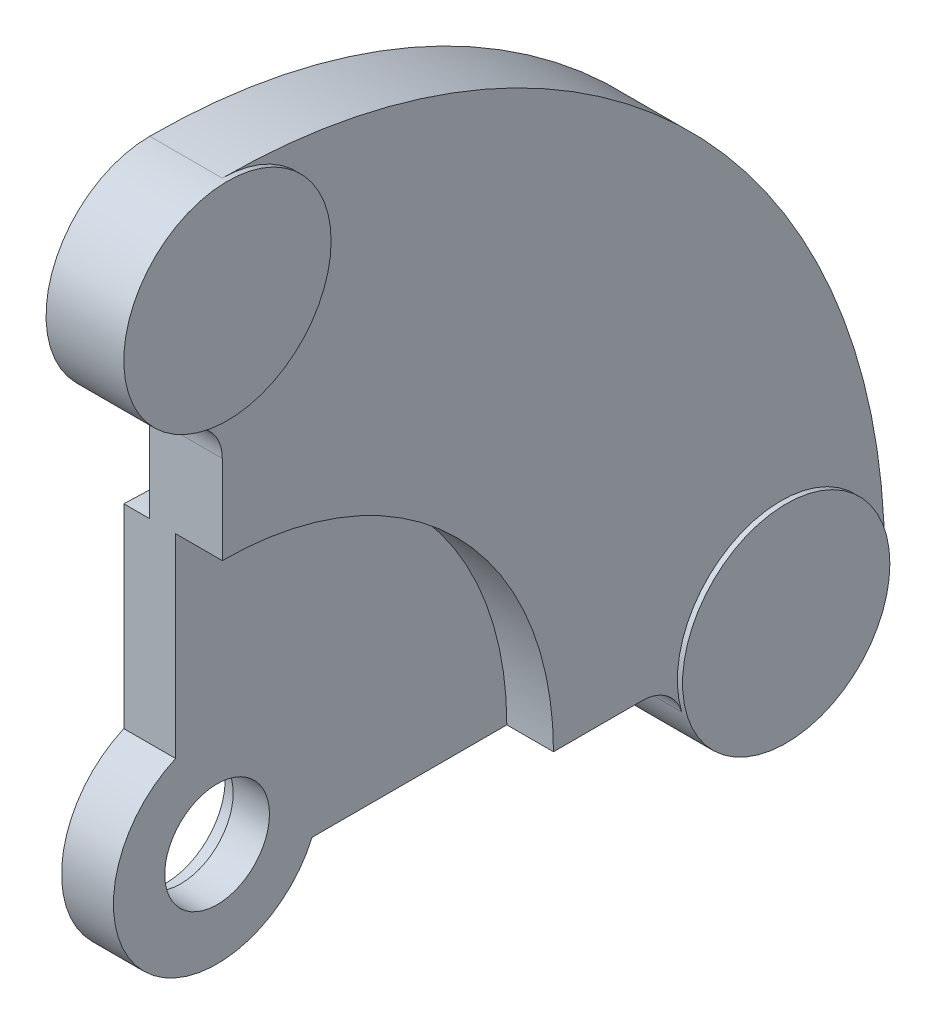
from build123d import *

# Parameters (mm, degrees)
SALIENTE_EXTRUIR1_DEPTH = 2.5
SALIENTE_EXTRUIR2_START = 7
SALIENTE_EXTRUIR2_DEPTH = 7
SALIENTE_EXTRUIR3_START = 7.5
CROQUIS2_4_R            = 10
SALIENTE_EXTRUIR3_DEPTH = 7.5
REDONDEO1_R             = 4
REDONDEO2_R             = 4
CROQUIS3_R              = 10
SALIENTE_EXTRUIR4_DEPTH = 5
CROQUIS4_R              = 5.05
CORTAR_EXTRUIR1_DEPTH   = 131
CROQUIS5_R              = 5.78
CORTAR_EXTRUIR2_DEPTH   = 1.5


with BuildPart() as part:
    # Croquis2 → Saliente-Extruir1 (new, symmetric)
    with BuildSketch(Plane(origin=(0, 0, 0), x_dir=(0, 0, -1), z_dir=(1, 0, 0))):
        with BuildLine():
            ThreePointArc((31.95, 0), (22.592061659, 22.592061659), (0, 31.95))
            Line((0, 31.95), (0, 0))
            Line((0, 0), (31.95, 0))
        make_face()
    extrude(amount=SALIENTE_EXTRUIR1_DEPTH, both=True)

    # Croquis2<3> → Saliente-Extruir2 (add)
    with BuildSketch(Plane(origin=(0, 0, 0), x_dir=(0, 0, -1), z_dir=(1, 0, 0)).offset(SALIENTE_EXTRUIR2_START)):
        with BuildLine():
            ThreePointArc((10, 53.9), (7.071067812, 46.828932188), (0, 43.9))
            Line((0, 43.9), (0, 31.95))
            ThreePointArc((0, 31.95), (22.592061659, 22.592061659), (31.95, 0))
            Line((31.95, 0), (43.9, 0))
            ThreePointArc((43.9, 0), (53.9, 10), (63.9, 0))
            ThreePointArc((63.9, 0), (45.184123318, 45.184123318), (0, 63.9))
            ThreePointArc((0, 63.9), (7.071067812, 60.971067812), (10, 53.9))
        make_face()
    extrude(amount=-SALIENTE_EXTRUIR2_DEPTH)

    # Croquis2<4> → Saliente-Extruir3 (add)
    with BuildSketch(Plane(origin=(0, 0, 0), x_dir=(0, 0, -1), z_dir=(1, 0, 0)).offset(SALIENTE_EXTRUIR3_START)):
        with Locations(Location((0, 53.9, 0), (0, 0, 270))):
            Circle(CROQUIS2_4_R)
        with Locations((53.9, 0)):
            Circle(CROQUIS2_4_R)
    extrude(amount=-SALIENTE_EXTRUIR3_DEPTH)

    # Redondeo1
    redondeo1_edges = [part.edges().sort_by_distance(p)[0] for p in [
        (0, 0, 0),
    ]]
    fillet(redondeo1_edges, radius=REDONDEO1_R)

    # Redondeo2
    # the kernel refuses this fillet: 4 mm, written as the material it adds along each edge
    with BuildSketch(Plane(origin=(7, 0, -43.9), x_dir=(0, 0, 1), z_dir=(-1, 0, 0))) as redondeo2_piece_1:
        with BuildLine():
            CenterArc((3.416407865, -4), REDONDEO2_R, 90, 73.398450401)
            ThreePointArc((-0.416851525, -2.857142857), (-0.104761631, -1.443695821), (0, 0))
            Line((0, 0), (3.416407865, 0))
        make_face()
    extrude(amount=7)
    with BuildSketch(Plane(origin=(7, 43.9, 0), x_dir=(0, -1, 0), z_dir=(-1, 0, 0))) as redondeo2_piece_2:
        with BuildLine():
            CenterArc((3.416407865, 4), REDONDEO2_R, 196.601549599, 73.398450401)
            ThreePointArc((-0.416851525, 2.857142857), (-0.104761631, 1.443695821), (0, 0))
            Line((0, 0), (3.416407865, 0))
        make_face()
    extrude(amount=7)

    # Croquis3 → Saliente-Extruir4 (add)
    with BuildSketch(Plane(origin=(2.5, 0, 0), x_dir=(0, 0, -1), z_dir=(1, 0, 0))):
        with Locations((4, 4)):
            Circle(CROQUIS3_R)
    extrude(amount=-SALIENTE_EXTRUIR4_DEPTH)

    # Croquis4 → Cortar-Extruir1 (cut)
    with BuildSketch(Plane(origin=(2.5, 0, 0), x_dir=(0, 0, -1), z_dir=(1, 0, 0))):
        with Locations((4, 4)):
            Circle(CROQUIS4_R)
    extrude(amount=-CORTAR_EXTRUIR1_DEPTH, mode=Mode.SUBTRACT)

    # Croquis5 → Cortar-Extruir2 (cut)
    with BuildSketch(Plane.ZY.offset(2.5)):
        with Locations((-4, 4)):
            Circle(CROQUIS5_R)
    extrude(amount=-CORTAR_EXTRUIR2_DEPTH, mode=Mode.SUBTRACT)


solid = part.part
